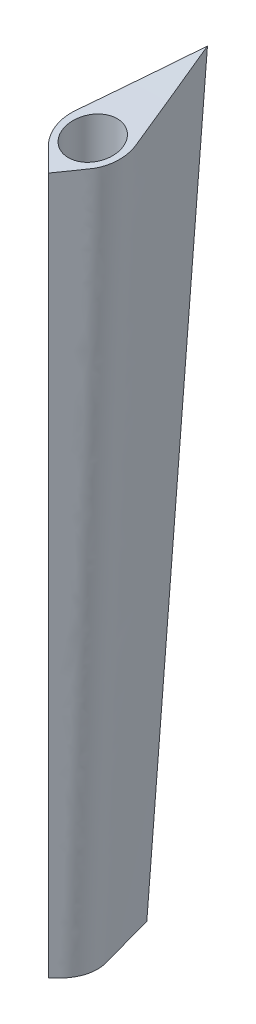
from build123d import *

# Parameters (mm, degrees)
POST_HOLE_R             = 10
CUT_EXTRUDE1_DEPTH      = 100
CUT_EXTRUDE2_DEPTH      = 244.732583295
CUT_EXTRUDE2_DEPTH_BACK = 244.732583295


with BuildPart() as part:
    # Loft1: read off the stored shape, not the designer's step
    # Loft1: loft between two sections, ruled curve by curve
    loft1_from = [
        Edge.make_bspline([(0, 0, -65), (1.090128751, 0, -61.366237497), (3.270747147, 0, -54.097509509), (6.471517091, 0, -43.428276362), (9.544840896, 0, -33.183863681), (11.485081194, 0, -26.716396019), (12.666432162, 0, -22.77855946), (12.968402106, 0, -21.305053815), (13.100609282, 0, -19.286967133), (12.978325762, 0, -17.392629287), (12.635490493, 0, -15.578921438), (12.073950502, 0, -13.82193497), (11.281547245, 0, -12.101334039), (10.209994947, 0, -10.396029742), (9.25103095, 0, -9.25103095), (8.163446408, 0, -8.163446408), (7.044301694, 0, -7.044301694), (4.665334779, 0, -4.665334779), (1.934160234, 0, -1.934160234), (0.587535045, 0, -0.587535045), (0, 0, 0)], [0, 0, 0, 0, 0.144398069, 0.288796138, 0.433194208, 0.577592277, 0.577592277, 0.614580384, 0.651568491, 0.688556598, 0.725544706, 0.762532813, 0.79952092, 0.836509027, 0.873497134, 0.873497134, 0.905122851, 0.936748567, 0.968374284, 1, 1, 1, 1], 3),
        Edge.make_line((0, 0, -65), (0, 0, 0)),
    ]
    loft1_to = [
        Edge.make_bspline([(0, -300, -40), (0.497105388, -300, -38.202262552), (1.498303235, -300, -34.581519535), (3.037083349, -300, -29.016658037), (4.633229436, -300, -23.244337598), (5.753794564, -300, -19.191913419), (6.484300851, -300, -16.550102367), (6.736474062, -300, -15.404380913), (6.917285676, -300, -13.486434812), (6.834511282, -300, -11.412388499), (6.44022099, -300, -9.278535319), (5.736721859, -300, -7.220345405), (4.785310579, -300, -5.360639369), (3.675318905, -300, -3.765229265), (2.883667943, -300, -2.883667943), (2.143164712, -300, -2.143164712), (1.762545696, -300, -1.762545696), (1.206796855, -300, -1.206796855), (0.680514831, -300, -0.680514831), (0.288861433, -300, -0.288861433), (0, -300, 0)], [0, 0, 0, 0, 0.144398069, 0.288796138, 0.433194208, 0.577592277, 0.577592277, 0.614580384, 0.651568491, 0.688556598, 0.725544706, 0.762532813, 0.79952092, 0.836509027, 0.873497134, 0.873497134, 0.905122851, 0.936748567, 0.968374284, 1, 1, 1, 1], 3),
        Edge.make_line((0, -300, -40), (0, -300, 0)),
    ]
    loft1 = Solid(Shell([*[Face.make_surface_from_curves(loft1_from[k], loft1_to[k]) for k in range(2)], Face(Wire(loft1_from)), Face(Wire(loft1_to))]))
    add(loft1)

    # Mirror1: Loft1 across plane
    add(loft1.mirror(Plane.ZY))

    # post_hole → Cut-Extrude1 (cut)
    with BuildSketch(Plane(origin=(0, 0, 0), x_dir=(1, 0, 0), z_dir=(0, 1, 0))):
        with Locations(Location((0, 18, 0), (0, 0, 270))):
            Circle(POST_HOLE_R)
    extrude(amount=-CUT_EXTRUDE1_DEPTH, mode=Mode.SUBTRACT)

    # Sketch1 → Cut-Extrude2 (cut, two sides: drawn at the far end of the back side and taken through both)
    with BuildSketch(Plane(origin=(-1.395234412, -236.356805311, -57.724602067), x_dir=(0.03510103444042518, 0, 0.9993837688201725), z_dir=(-0.9993837688201725, 0, 0.03510103444042518)).offset(-CUT_EXTRUDE2_DEPTH_BACK)):
        with BuildLine():
            Line((-6.901046872, 232.503708167), (-7.221940435, 236.356805311))
            Line((-7.221940435, 236.356805311), (34.607125692, 236.356805311))
            Line((34.607125692, 236.356805311), (49.382745775, 236.356805311))
            Line((49.382745775, 236.356805311), (57.738004539, 236.356805311))
            Line((57.738004539, 236.356805311), (57.738004539, 220.068385372))
            add(Edge.make_bspline(
                [(-6.901046872, 232.503708167), (14.59060476, 228.075000406), (36.140920736, 223.929205599), (57.738004539, 220.068385372)],
                knots=[0.014685246, 0.014685246, 0.014685246, 0.014685246, 0.066243156, 0.066243156, 0.066243156, 0.066243156], degree=3))
        make_face()
    extrude(amount=CUT_EXTRUDE2_DEPTH + CUT_EXTRUDE2_DEPTH_BACK, mode=Mode.SUBTRACT)


solid = part.part
